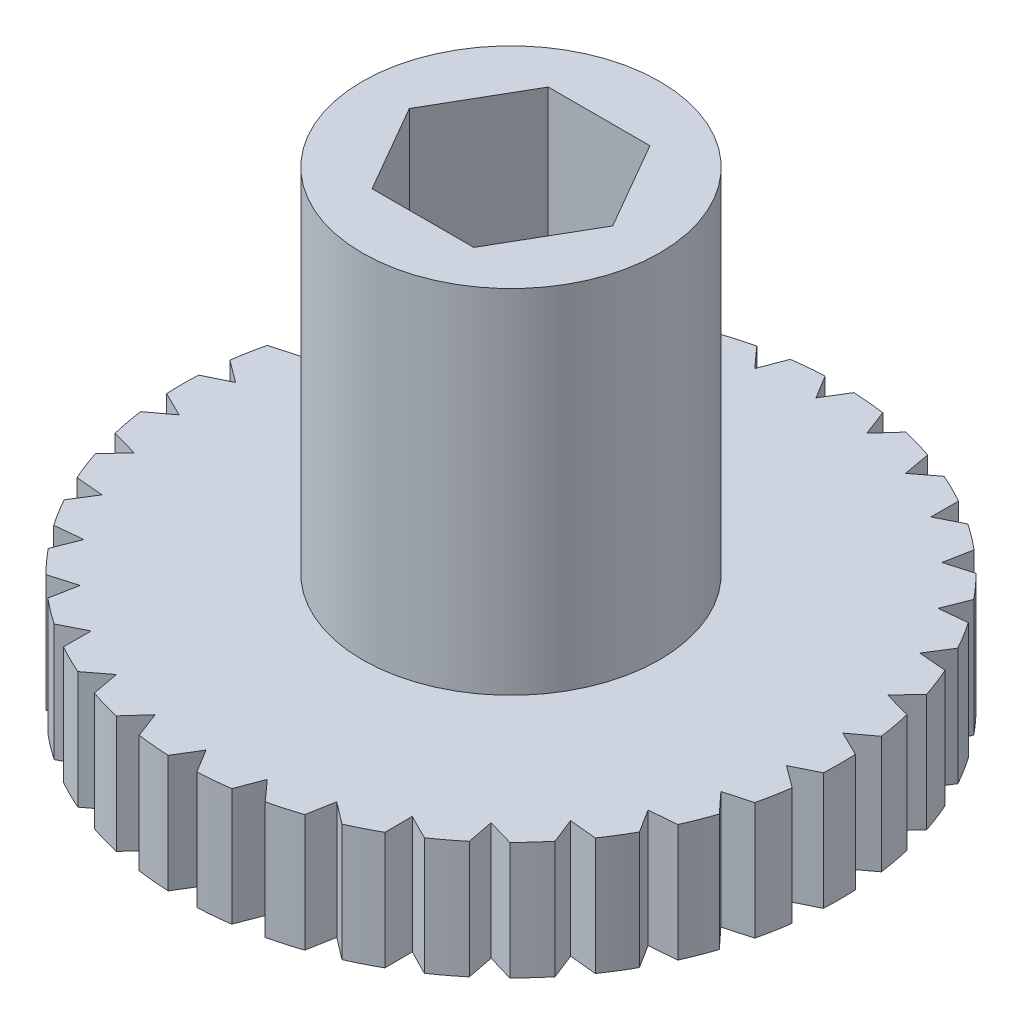
from build123d import *

# Parameters (mm, degrees)
SKETCH1_R               = 14
BOSS_EXTRUDE1_DEPTH     = 5
CUT_EXTRUDE1_DEPTH      = 21.420577857
CUT_EXTRUDE1_DEPTH_BACK = 21.420577857
SKETCH4_R               = 6.330127019
BOSS_EXTRUDE3_DEPTH     = 15
CUT_EXTRUDE6_START      = -10
CUT_EXTRUDE6_DEPTH      = 10
CIRPATTERN1_COUNT       = 34


with BuildPart() as part:
    # Sketch1 → Boss-Extrude1 (new body)
    with BuildSketch(Plane(origin=(0, 0, 0), x_dir=(1, 0, 0), z_dir=(0, 1, 0))):
        Circle(SKETCH1_R)
    extrude(amount=-BOSS_EXTRUDE1_DEPTH)

    # Sketch3 → Cut-Extrude1 (cut, two sides: drawn at the far end of the back side and taken through both)
    with BuildSketch(Plane(origin=(0, 0, 0), x_dir=(1, 0, 0), z_dir=(0, 1, 0)).offset(-CUT_EXTRUDE1_DEPTH_BACK)):
        Polygon((4.330127019, 0), (2.165063509, 3.75), (-2.165063509, 3.75), (-4.330127019, 0), (-2.165063509, -3.75), (2.165063509, -3.75), align=None)
    extrude(amount=CUT_EXTRUDE1_DEPTH + CUT_EXTRUDE1_DEPTH_BACK, mode=Mode.SUBTRACT)

    # Sketch4 → Boss-Extrude3 (add)
    with BuildSketch(Plane(origin=(0, 0, 0), x_dir=(1, 0, 0), z_dir=(0, 1, 0))):
        Circle(SKETCH4_R)
        Polygon((4.330127019, 0), (2.165063509, 3.75), (-2.165063509, 3.75), (-4.330127019, 0), (-2.165063509, -3.75), (2.165063509, -3.75), align=None, mode=Mode.SUBTRACT)
    extrude(amount=BOSS_EXTRUDE3_DEPTH)

    # Sketch6 → Cut-Extrude6 (cut)
    with BuildSketch(Plane.XZ.offset(5).offset(CUT_EXTRUDE6_START)):
        with BuildLine():
            Line((0.610671423, -13.986675102), (0, -12.986675102))
            Line((0, -12.986675102), (-0.610671423, -13.986675102))
            ThreePointArc((-0.610671423, -13.986675102), (0, -14), (0.610671423, -13.986675102))
        make_face()
    cut_extrude6 = extrude(amount=CUT_EXTRUDE6_DEPTH, mode=Mode.SUBTRACT)

    # CirPattern1: Cut-Extrude6 ×34 about axis
    cirpattern1_axis = Axis((0, 0, 0), (0, -1, 0))
    for i in range(1, CIRPATTERN1_COUNT):
        add(cut_extrude6.rotate(cirpattern1_axis, i * 360 / CIRPATTERN1_COUNT), mode=Mode.SUBTRACT)


solid = part.part
